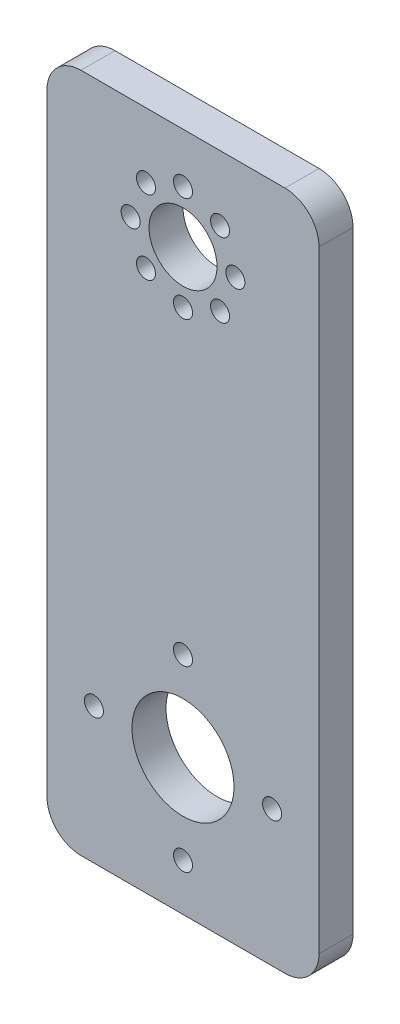
from build123d import *

# Parameters (mm, degrees)
SKETCH1_W           = 50.8
SKETCH1_H           = 127
SKETCH1_R           = 9.525
SKETCH1_R_2         = 6.35
BOSS_EXTRUDE1_DEPTH = 6.35
SKETCH2_R           = 1.778
CUT_EXTRUDE1_DEPTH  = 6.35
CIRPATTERN1_COUNT   = 4
SKETCH3_R           = 1.778
CUT_EXTRUDE2_DEPTH  = 6.35
CIRPATTERN2_COUNT   = 8
FILLET1_R           = 6.35


with BuildPart() as part:
    # Sketch1 → Boss-Extrude1 (new body)
    with BuildSketch(Plane.XY):
        with Locations((25.4, 63.5)):
            Rectangle(SKETCH1_W, SKETCH1_H)
        with Locations((25.4, 25.4)):
            Circle(SKETCH1_R, mode=Mode.SUBTRACT)
        with Locations((25.4, 107.95)):
            Circle(SKETCH1_R_2, mode=Mode.SUBTRACT)
    extrude(amount=BOSS_EXTRUDE1_DEPTH)

    # Sketch2 → Cut-Extrude1 (cut)
    with BuildSketch(Plane.XY.offset(6.35)):
        with Locations((25.4, 42.037)):
            Circle(SKETCH2_R)
    cut_extrude1 = extrude(amount=-CUT_EXTRUDE1_DEPTH, mode=Mode.SUBTRACT)

    # CirPattern1: Cut-Extrude1 ×4 about axis
    cirpattern1_axis = Axis((25.4, 25.4, 6.35), (0, 0, 1))
    for i in range(1, CIRPATTERN1_COUNT):
        add(cut_extrude1.rotate(cirpattern1_axis, i * 360 / CIRPATTERN1_COUNT), mode=Mode.SUBTRACT)

    # Sketch3 → Cut-Extrude2 (cut)
    with BuildSketch(Plane.XY.offset(6.35)):
        with Locations((25.4, 117.729)):
            Circle(SKETCH3_R)
    cut_extrude2 = extrude(amount=-CUT_EXTRUDE2_DEPTH, mode=Mode.SUBTRACT)

    # CirPattern2: Cut-Extrude2 ×8 about axis
    cirpattern2_axis = Axis((25.4, 107.95, 6.35), (0, 0, 1))
    for i in range(1, CIRPATTERN2_COUNT):
        add(cut_extrude2.rotate(cirpattern2_axis, i * 360 / CIRPATTERN2_COUNT), mode=Mode.SUBTRACT)

    # Fillet1
    fillet1_edges = [part.edges().sort_by_distance(p)[0] for p in [
        (0, 0, 3.175),
        (50.8, 0, 3.175),
        (0, 127, 3.175),
        (50.8, 127, 3.175),
    ]]
    fillet(fillet1_edges, radius=FILLET1_R)


solid = part.part
